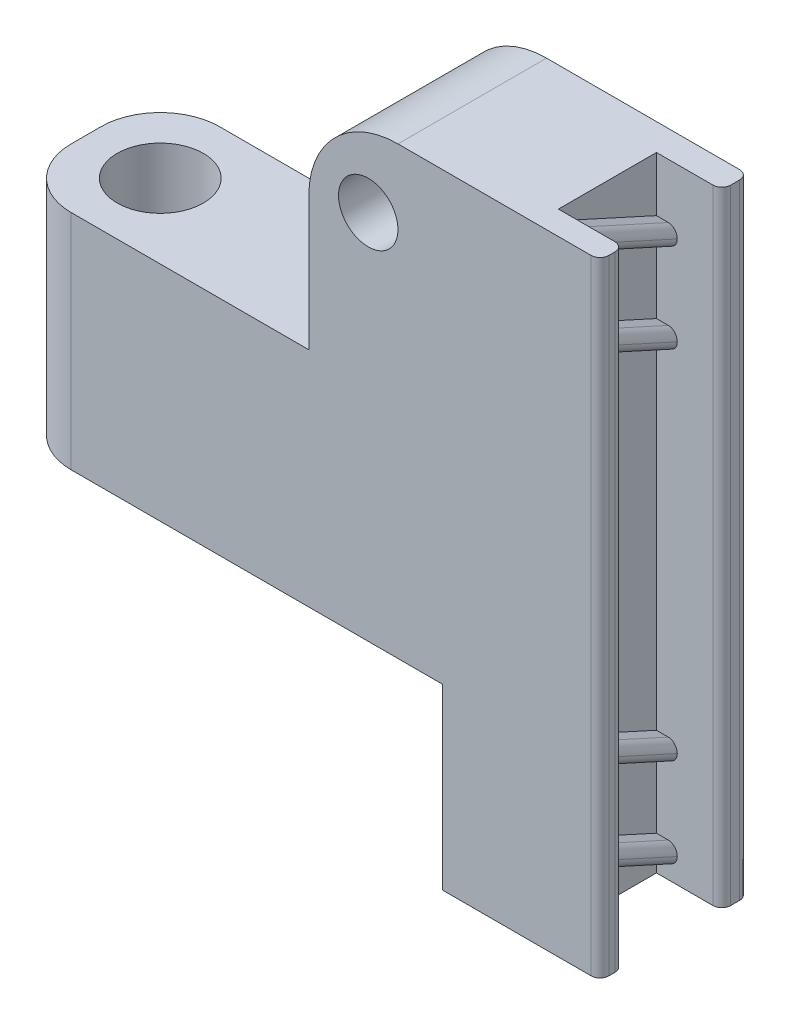
from build123d import *

# Parameters (mm, degrees)
SKETCH_1_R          = 1.45
EXTRUDE_1_DEPTH     = 21
EXTRUDE_2_DEPTH     = 1.3
FILLET_1_R          = 0.3
FILLET_2_R          = 0.3
SKETCH_3_R          = 1
CUT_EXTRUDE_3_DEPTH = 10
FILLET_3_R          = 2
SKETCH_4_W          = 3.3
SKETCH_4_H          = 21
EXTRUDE_4_DEPTH     = 0.6
SKETCH_7_W          = 15
SKETCH_7_H          = 13.536537926
SKETCH_7_W_2        = 10.5
SKETCH_7_H_2        = 9.5
CUT_EXTRUDE_4_DEPTH = 10
FILLET_7_R          = 3


with BuildPart() as part:
    # 草圖1 → 填料-伸長1 (new body)
    with BuildSketch(Plane(origin=(0, 0, 0), x_dir=(1, 0, 0), z_dir=(0, 1, 0))):
        Polygon((17.3, -0.9), (14.5, -0.9), (14.5, -4.2), (17.3, -4.2), (17.3, -5), (0, -5), (-2.5, -5), (-2.5, 0), (0, 0), (17.3, 0), align=None)
        with Locations(Location((0, -2.5, 0), (0, 0, 90))):
            Circle(SKETCH_1_R, mode=Mode.SUBTRACT)
    extrude(amount=EXTRUDE_1_DEPTH)

    # 草圖2 → 填料-伸長2 (add)
    with BuildSketch(Plane(origin=(14.5, 0, 0), x_dir=(0, 0, -1), z_dir=(1, 0, 0))):
        Polygon((-4.2, 5.659075235), (-0.9, 4.159075235), (-0.9, 3.5), (-4.2, 5), align=None)
        Polygon((-4.2, 2.659075235), (-0.9, 1.159075235), (-0.9, 0.5), (-4.2, 2), align=None)
        Polygon((-4.2, 17.659075235), (-0.9, 16.159075235), (-0.9, 15.5), (-4.2, 17), align=None)
        Polygon((-4.2, 20.659075235), (-0.9, 19.159075235), (-0.9, 18.5), (-4.2, 20), align=None)
    extrude(amount=EXTRUDE_2_DEPTH)

    # 圓角1
    fillet_1_edges = [part.edges().sort_by_distance(p)[0] for p in [
        (15.8, 1.909075235, 2.55),
        (15.8, 1.25, 2.55),
        (15.8, 4.25, 2.55),
        (15.8, 4.909075235, 2.55),
        (15.8, 16.25, 2.55),
        (15.8, 16.909075235, 2.55),
        (15.8, 19.25, 2.55),
        (15.8, 19.909075235, 2.55),
    ]]
    fillet(fillet_1_edges, radius=FILLET_1_R - 0.0001)  # a hair under: the kernel refuses the full size

    # 圓角2
    fillet_2_edges = [part.edges().sort_by_distance(p)[0] for p in [
        (17.3, 10.5, 0),
        (17.3, 10.5, 0.9),
        (17.3, 10.5, 4.2),
        (17.3, 10.5, 5),
    ]]
    fillet(fillet_2_edges, radius=FILLET_2_R)

    # 草圖3 → 除料-伸長3 (cut)
    with BuildSketch(Plane.XY):
        with Locations(Location((9.5, 18.5, 0), (0, 0, 180))):
            Circle(SKETCH_3_R)
    extrude(amount=CUT_EXTRUDE_3_DEPTH, mode=Mode.SUBTRACT)

    # 圓角3
    fillet_3_edges = [part.edges().sort_by_distance(p)[0] for p in [
        (-2.5, 10.5, 5),
        (-2.5, 10.5, 0),
    ]]
    fillet(fillet_3_edges, radius=FILLET_3_R)

    # 草圖4 → 填料-伸長4 (add)
    with BuildSketch(Plane(origin=(14.5, 0, 0), x_dir=(0, 0, -1), z_dir=(1, 0, 0))):
        with Locations((-2.55, 10.5)):
            Rectangle(SKETCH_4_W, SKETCH_4_H)
    extrude(amount=EXTRUDE_4_DEPTH)

    # 草圖7 → 除料-伸長4 (cut)
    with BuildSketch(Plane.XY.offset(5)):
        with Locations((4.5, -0.768268963)):
            Rectangle(SKETCH_7_W, SKETCH_7_H)
        with Locations((2.25, 18.25)):
            Rectangle(SKETCH_7_W_2, SKETCH_7_H_2)
    extrude(amount=-CUT_EXTRUDE_4_DEPTH, mode=Mode.SUBTRACT)

    # 圓角7
    fillet_7_edges = [part.edges().sort_by_distance(p)[0] for p in [
        (7.5, 21, 2.5),
    ]]
    fillet(fillet_7_edges, radius=FILLET_7_R)


solid = part.part
